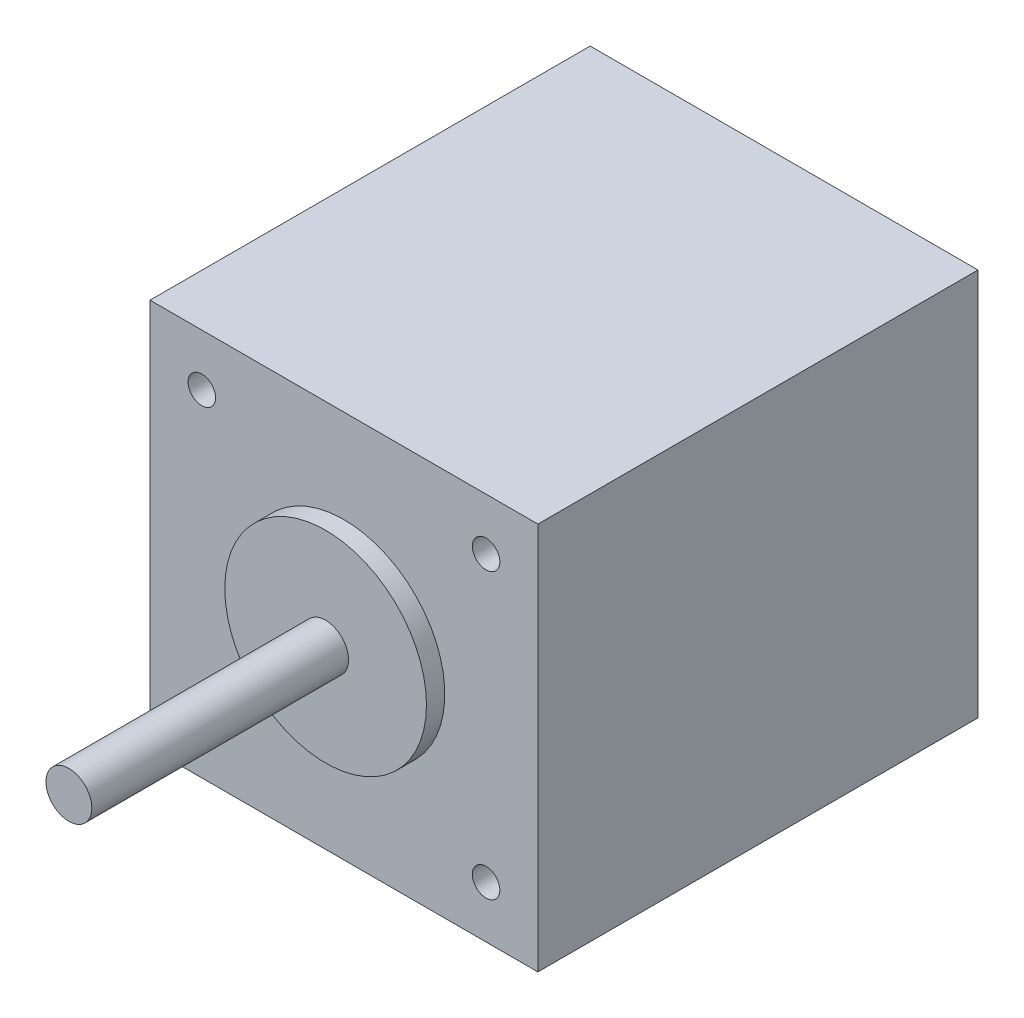
from build123d import *

# Parameters (mm, degrees)
SKETCH_1_W          = 42.3
SKETCH_1_H          = 42.3
EXTRUDE_1560_DEPTH  = 48
SKETCH_2_R          = 2.5
EXTRUDE_1606_DEPTH  = 78
SKETCH_3_R          = 11
EXTRUDE_1651_DEPTH  = 50
CUT_EXTRUDE_START   = 48
SKETCH_5_R          = 1.5
CUT_EXTRUDE_3_DEPTH = 4.5


with BuildPart() as part:
    # Эскиз1 → Extrude 1560 (new body)
    with BuildSketch(Plane.XY):
        Rectangle(SKETCH_1_W, SKETCH_1_H)
    extrude(amount=EXTRUDE_1560_DEPTH)

    # Эскиз2 → Extrude 1606 (add)
    with BuildSketch(Plane.XY):
        Circle(SKETCH_2_R)
    extrude(amount=EXTRUDE_1606_DEPTH)

    # Эскиз3 → Extrude 1651 (add)
    with BuildSketch(Plane.XY):
        Circle(SKETCH_3_R)
    extrude(amount=EXTRUDE_1651_DEPTH)

    # Эскиз5 → Крепеж_М3_ПРЕДВ (cut)
    with BuildSketch(Plane.XY.offset(CUT_EXTRUDE_START)):
        with Locations((-15.5, -15.5)):
            Circle(SKETCH_5_R)
        with Locations((-15.5, 15.5)):
            Circle(SKETCH_5_R)
        with Locations((15.5, -15.5)):
            Circle(SKETCH_5_R)
        with Locations((15.5, 15.5)):
            Circle(SKETCH_5_R)
    extrude(amount=-CUT_EXTRUDE_3_DEPTH, mode=Mode.SUBTRACT)


solid = part.part
